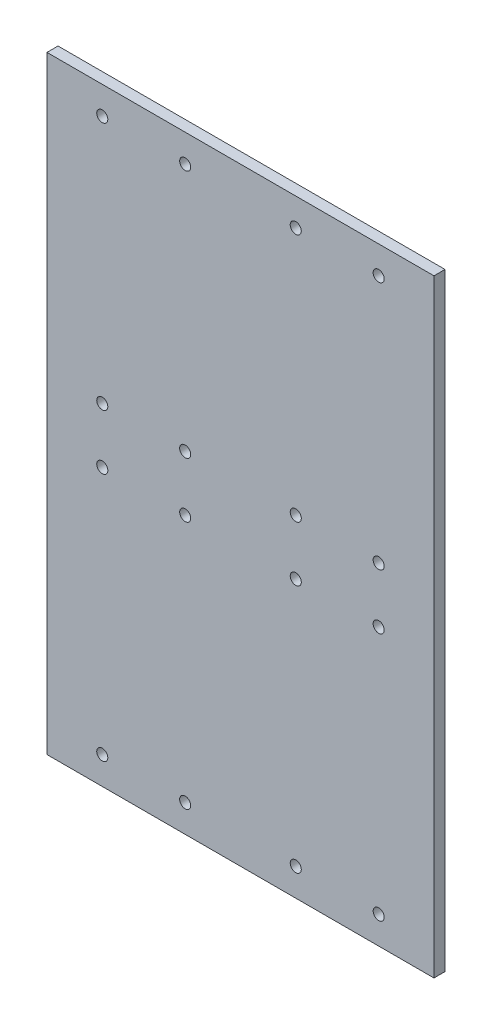
from build123d import *

# Parameters (mm, degrees)
SKETCH_1_W               = 70
SKETCH_1_H               = 110
EXTRUDE_1_DEPTH          = 2
SKETCH_2_R               = 1
CUT_EXTRUDE_4_DEPTH      = 66.222695436
MIRROR_6_COPY_1_SKETCH_R = 1
MIRROR_6_COPY_1_DEPTH    = 66.222695436
MIRROR_6_COPY_2_SKETCH_R = 1
MIRROR_6_COPY_2_DEPTH    = 66.222695436


with BuildPart() as part:
    # ｽｹｯﾁ1 → ﾎﾞｽ - 押し出し1 (new body)
    with BuildSketch(Plane.XY):
        Rectangle(SKETCH_1_W, SKETCH_1_H)
    extrude(amount=EXTRUDE_1_DEPTH)

    # ｽｹｯﾁ2 → ｶｯﾄ - 押し出し4 (cut, symmetric)
    with BuildSketch(Plane.XY):
        with Locations((10, -5)):
            Circle(SKETCH_2_R)
        with Locations((25, -5)):
            Circle(SKETCH_2_R)
        with Locations((10, -50)):
            Circle(SKETCH_2_R)
        with Locations((25, -50)):
            Circle(SKETCH_2_R)
    cut_extrude_4 = extrude(amount=CUT_EXTRUDE_4_DEPTH, both=True, mode=Mode.SUBTRACT)

    # ﾐﾗｰ2: ｶｯﾄ - 押し出し4 across plane
    add(cut_extrude_4.mirror(Plane(origin=(0, 0, 0), x_dir=(0, 0, 1), z_dir=(1, 0, 0))), mode=Mode.SUBTRACT)

    # ﾐﾗｰ6 copy 1 sketch → ﾐﾗｰ6 copy 1 (cut, symmetric)
    with BuildSketch(Plane(origin=(0, 0, 0), x_dir=(-1, 0, 0), z_dir=(0, 0, 1))):
        with Locations((10, -5)):
            Circle(MIRROR_6_COPY_1_SKETCH_R)
        with Locations((25, -5)):
            Circle(MIRROR_6_COPY_1_SKETCH_R)
        with Locations((10, -50)):
            Circle(MIRROR_6_COPY_1_SKETCH_R)
        with Locations((25, -50)):
            Circle(MIRROR_6_COPY_1_SKETCH_R)
    extrude(amount=MIRROR_6_COPY_1_DEPTH, both=True, mode=Mode.SUBTRACT)

    # ﾐﾗｰ6 copy 2 sketch → ﾐﾗｰ6 copy 2 (cut, symmetric)
    with BuildSketch(Plane.XY):
        with Locations((10, 5)):
            Circle(MIRROR_6_COPY_2_SKETCH_R)
        with Locations((25, 5)):
            Circle(MIRROR_6_COPY_2_SKETCH_R)
        with Locations((10, 50)):
            Circle(MIRROR_6_COPY_2_SKETCH_R)
        with Locations((25, 50)):
            Circle(MIRROR_6_COPY_2_SKETCH_R)
    extrude(amount=MIRROR_6_COPY_2_DEPTH, both=True, mode=Mode.SUBTRACT)


solid = part.part
